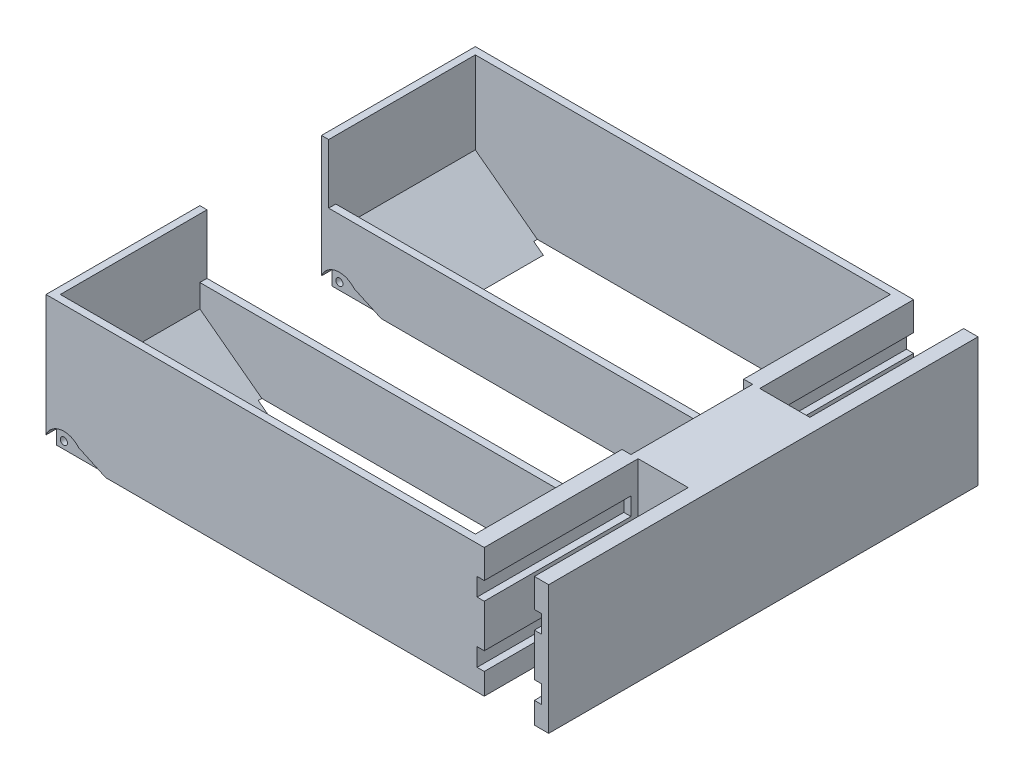
from build123d import *

# Parameters (mm, degrees)
SKETCH2_W            = 120
SKETCH2_H            = 43
BOSS_EXTRUDE1_DEPTH  = 38
SKETCH3_W            = 116
SKETCH3_H            = 39
CUT_EXTRUDE1_DEPTH   = 38
BOSS_EXTRUDE2_DEPTH  = 39
SKETCH5_W            = 43
SKETCH5_H            = 38
BOSS_EXTRUDE3_DEPTH  = 2.5
SKETCH6_W            = 2
SKETCH6_H            = 38
BOSS_EXTRUDE4_DEPTH  = 17
SKETCH7_W            = 34
SKETCH7_H            = 38
BOSS_EXTRUDE5_DEPTH  = 18
SKETCH8_W            = 4
SKETCH8_H            = 38
BOSS_EXTRUDE6_DEPTH  = 43
SKETCH9_W            = 18
SKETCH9_H            = 5
CUT_EXTRUDE2_DEPTH   = 41
SKETCH11_W           = 120
SKETCH11_H           = 2
CUT_EXTRUDE3_DEPTH   = 118.5
CUT_EXTRUDE4_DEPTH   = 3
MIRROR4_COPY_1_DEPTH = 3
CUT_EXTRUDE5_START   = -114
SKETCH13_R           = 1
CUT_EXTRUDE5_DEPTH   = 114
SKETCH14_W           = 116
SKETCH14_H           = 2
CUT_EXTRUDE6_DEPTH   = 16.6
SKETCH15_R           = 1.75
CUT_EXTRUDE7_DEPTH   = 1


with BuildPart() as part:
    # Sketch2 → Boss-Extrude1 (new body)
    with BuildSketch(Plane(origin=(0, 0, 0), x_dir=(1, 0, 0), z_dir=(0, 1, 0))):
        Rectangle(SKETCH2_W, SKETCH2_H)
    extrude(amount=BOSS_EXTRUDE1_DEPTH)

    # Sketch3 → Cut-Extrude1 (cut)
    with BuildSketch(Plane(origin=(0, 38, 0), x_dir=(1, 0, 0), z_dir=(0, 1, 0))):
        Rectangle(SKETCH3_W, SKETCH3_H)
    extrude(amount=-CUT_EXTRUDE1_DEPTH, mode=Mode.SUBTRACT)

    # Sketch4 → Boss-Extrude2 (add)
    with BuildSketch(Plane.XY.offset(-19.5)):
        Polygon((-58, 0), (-58, 15), (-38, 0), align=None)
    extrude(amount=BOSS_EXTRUDE2_DEPTH)

    # Sketch5 → Boss-Extrude3 (add)
    with BuildSketch(Plane(origin=(60, 0, 0), x_dir=(0, 0, -1), z_dir=(1, 0, 0))):
        with Locations((0, 19)):
            Rectangle(SKETCH5_W, SKETCH5_H)
    extrude(amount=BOSS_EXTRUDE3_DEPTH)

    # Sketch6 → Boss-Extrude4 (add)
    with BuildSketch(Plane(origin=(0, 0, -21.5), x_dir=(-1, 0, 0), z_dir=(0, 0, -1))):
        with Locations((-61.5, 19)):
            Rectangle(SKETCH6_W, SKETCH6_H)
    extrude(amount=BOSS_EXTRUDE4_DEPTH)

    # Mirror1: part across plane


with BuildPart() as part_1:
    add(part.part)
    add(part.part.mirror(Plane(origin=(0, 0, -38.5), x_dir=(1, 0, 0), z_dir=(0, 0, -1))))

    # Sketch7 → Boss-Extrude5 (add)
    with BuildSketch(Plane(origin=(62.5, 0, 0), x_dir=(0, 0, -1), z_dir=(1, 0, 0))):
        with Locations((38.5, 19)):
            Rectangle(SKETCH7_W, SKETCH7_H)
    extrude(amount=BOSS_EXTRUDE5_DEPTH)

    # Sketch8 → Boss-Extrude6 (add)
    with BuildSketch(Plane.XY.offset(-21.5)):
        with Locations((78.5, 19)):
            Rectangle(SKETCH8_W, SKETCH8_H)
    boss_extrude6 = extrude(amount=BOSS_EXTRUDE6_DEPTH)

    # Sketch9 → Cut-Extrude2 (cut)
    with BuildSketch(Plane.XY.offset(21.5)):
        with Locations((69.5, 27.5)):
            Rectangle(SKETCH9_W, SKETCH9_H)
        with Locations((69.5, 10.5)):
            Rectangle(SKETCH9_W, SKETCH9_H)
    cut_extrude2 = extrude(amount=-CUT_EXTRUDE2_DEPTH, mode=Mode.SUBTRACT)

    # Mirror2: Boss-Extrude6, Cut-Extrude2 across plane
    add(boss_extrude6.mirror(Plane(origin=(0, 0, -38.5), x_dir=(1, 0, 0), z_dir=(0, 0, -1))))
    add(cut_extrude2.mirror(Plane(origin=(0, 0, -38.5), x_dir=(1, 0, 0), z_dir=(0, 0, -1))), mode=Mode.SUBTRACT)

    # Sketch11 → Cut-Extrude3 (cut)
    with BuildSketch(Plane(origin=(80.5, 0, 0), x_dir=(0, 0, -1), z_dir=(1, 0, 0))):
        with Locations((38.5, 1)):
            Rectangle(SKETCH11_W, SKETCH11_H)
    extrude(amount=-CUT_EXTRUDE3_DEPTH, mode=Mode.SUBTRACT)

    # Sketch12 → Cut-Extrude4 (cut)
    with BuildSketch(Plane.XY.offset(21.5)):
        with BuildLine():
            Line((-38, 2), (-49.614835193, 2))
            ThreePointArc((-49.614835193, 2), (-56.018375168, 7.287996976), (-60, 0))
            Line((-60, 0), (-38, 0))
            Line((-38, 0), (-38, 2))
        make_face()
    cut_extrude4 = extrude(amount=-CUT_EXTRUDE4_DEPTH, mode=Mode.SUBTRACT)

    # Mirror3: Cut-Extrude4 across plane
    add(cut_extrude4.mirror(Plane.XY), mode=Mode.SUBTRACT)

    # Mirror4: Cut-Extrude4 across plane
    add(cut_extrude4.mirror(Plane(origin=(0, 0, -38.5), x_dir=(1, 0, 0), z_dir=(0, 0, -1))), mode=Mode.SUBTRACT)

    # Mirror4 copy 1 sketch → Mirror4 copy 1 (cut)
    with BuildSketch(Plane.XY.offset(-55.5)):
        with BuildLine():
            Line((-38, 2), (-49.614835193, 2))
            ThreePointArc((-49.614835193, 2), (-56.018375168, 7.287996976), (-60, 0))
            Line((-60, 0), (-38, 0))
            Line((-38, 0), (-38, 2))
        make_face()
    extrude(amount=-MIRROR4_COPY_1_DEPTH, mode=Mode.SUBTRACT)

    # Sketch13 → Cut-Extrude5 (cut)
    with BuildSketch(Plane.XY.offset(18.5).offset(CUT_EXTRUDE5_START)):
        with Locations((-58, 2)):
            Circle(SKETCH13_R)
    extrude(amount=CUT_EXTRUDE5_DEPTH, mode=Mode.SUBTRACT)

    # Chamfer1
    # the kernel refuses this chamfer: 10 mm, written as the material it takes off along each edge
    with BuildSketch(Plane(origin=(-49.614835193, 2, 38.180669666), x_dir=(-0.41152080336556635, 0.9114003666870882, 0), z_dir=(0, 0, -1))) as chamfer1_piece_1:
        with BuildLine():
            Line((4.024103798, 0), (-2.897424879, 6.010331734))
            Line((-2.897424879, 6.010331734), (-3.079704953, 5.928027573))
            ThreePointArc((-3.079704953, 5.928027573), (-1.554736759, 2.957293148), (-0.182280073, -0.082304161))
            Line((-0.182280073, -0.082304161), (0.082304161, -0.182280073))
            ThreePointArc((0.082304161, -0.182280073), (2.000716354, 0.27264804), (3.968173362, -0.192020276))
            Line((3.968173362, -0.192020276), (4.024103798, 0))
        make_face()
    extrude(amount=19.680669666, mode=Mode.SUBTRACT)

    # Chamfer2
    # the kernel refuses this chamfer: 10 mm, written as the material it takes off along each edge
    with BuildSketch(Plane(origin=(-49.614835193, 2, -38.180669666), x_dir=(0.9996854583228201, -0.0250795617564035, 0), z_dir=(0, 0, 1))) as chamfer2_piece_1:
        with BuildLine():
            Line((6.672267866, 0), (-1.747462586, 3.624884258))
            Line((-1.747462586, 3.624884258), (-1.896145364, 3.491117927))
            ThreePointArc((-1.896145364, 3.491117927), (-0.623209418, 1.920628258), (-0.199937092, -0.005015912))
            Line((-0.199937092, -0.005015912), (0.005015912, -0.199937092))
            ThreePointArc((0.005015912, -0.199937092), (3.339051469, -0.116294632), (6.677283779, -0.199937092))
            Line((6.677283779, -0.199937092), (6.672267866, 0))
        make_face()
    extrude(amount=19.680669666, mode=Mode.SUBTRACT)

    # Chamfer3
    # the kernel refuses this chamfer: 10 mm, written as the material it takes off along each edge
    with BuildSketch(Plane(origin=(-49.614835193, 2, -38.819330334), x_dir=(0.9996854583228201, -0.02507956175640344, 0), z_dir=(0, 0, -1))) as chamfer3_piece_1:
        with BuildLine():
            Line((6.672267866, 0), (-1.747462586, -3.624884258))
            Line((-1.747462586, -3.624884258), (-1.896145364, -3.491117927))
            ThreePointArc((-1.896145364, -3.491117927), (-0.623209418, -1.920628258), (-0.199937092, 0.005015912))
            Line((-0.199937092, 0.005015912), (0.005015912, 0.199937092))
            ThreePointArc((0.005015912, 0.199937092), (3.339051469, 0.116294632), (6.677283779, 0.199937092))
            Line((6.677283779, 0.199937092), (6.672267866, 0))
        make_face()
    extrude(amount=19.680669666, mode=Mode.SUBTRACT)

    # Chamfer4
    # the kernel refuses this chamfer: 10 mm, written as the material it takes off along each edge
    with BuildSketch(Plane(origin=(-49.614835193, 2, -115.180669666), x_dir=(0.9996854583228201, -0.0250795617564035, 0), z_dir=(0, 0, 1))) as chamfer4_piece_1:
        with BuildLine():
            Line((6.672267866, 0), (-1.747462586, 3.624884258))
            Line((-1.747462586, 3.624884258), (-1.896145364, 3.491117927))
            ThreePointArc((-1.896145364, 3.491117927), (-0.623209418, 1.920628258), (-0.199937092, -0.005015912))
            Line((-0.199937092, -0.005015912), (0.005015912, -0.199937092))
            ThreePointArc((0.005015912, -0.199937092), (3.339051469, -0.116294632), (6.677283779, -0.199937092))
            Line((6.677283779, -0.199937092), (6.672267866, 0))
        make_face()
    extrude(amount=19.680669666, mode=Mode.SUBTRACT)

    # Sketch14 → Cut-Extrude6 (cut)
    with BuildSketch(Plane(origin=(0, 38, 0), x_dir=(1, 0, 0), z_dir=(0, 1, 0))):
        with Locations((0, 20.5)):
            Rectangle(SKETCH14_W, SKETCH14_H)
    cut_extrude6 = extrude(amount=-CUT_EXTRUDE6_DEPTH, mode=Mode.SUBTRACT)

    # Mirror5: Cut-Extrude6 across plane
    add(cut_extrude6.mirror(Plane(origin=(0, 0, -38.5), x_dir=(1, 0, 0), z_dir=(0, 0, -1))), mode=Mode.SUBTRACT)

    # Sketch15 → Cut-Extrude7 (cut)
    with BuildSketch(Plane.XY.offset(-21.5)):
        with Locations((70.2, 21.1)):
            Circle(SKETCH15_R)
    cut_extrude7 = extrude(amount=-CUT_EXTRUDE7_DEPTH, mode=Mode.SUBTRACT)

    # Mirror6: Cut-Extrude7 across plane
    add(cut_extrude7.mirror(Plane(origin=(0, 0, -38.5), x_dir=(1, 0, 0), z_dir=(0, 0, -1))), mode=Mode.SUBTRACT)


solid = part_1.part
